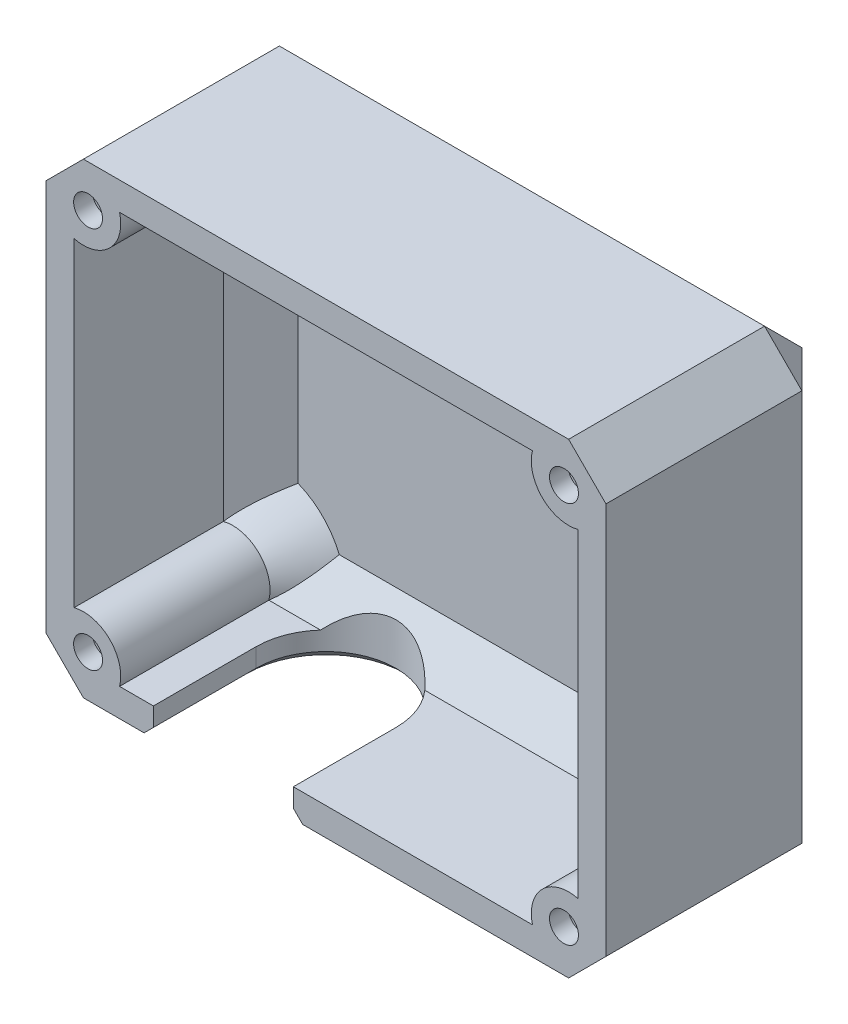
from build123d import *

# Parameters (mm, degrees)
SKETCH1_W           = 60
SKETCH1_H           = 50
BOSS_EXTRUDE1_DEPTH = 5
SKETCH2_W           = 60
SKETCH2_H           = 50
BOSS_EXTRUDE2_DEPTH = 20
CHAMFER1_SIZE       = 4
CHAMFER2_SIZE       = 4
CUT_EXTRUDE1_REACH  = 84.006
SKETCH5_R           = 1.55
CUT_EXTRUDE2_DEPTH  = 2
CHAMFER3_SIZE       = 1


with BuildPart() as part:
    # Sketch1 → Boss-Extrude1 (new body)
    with BuildSketch(Plane.XY):
        with Locations((30, 25)):
            Rectangle(SKETCH1_W, SKETCH1_H)
    extrude(amount=BOSS_EXTRUDE1_DEPTH)

    # Sketch2 → Boss-Extrude2 (add)
    with BuildSketch(Plane.XY.offset(5)):
        with Locations((30, 25)):
            Rectangle(SKETCH2_W, SKETCH2_H)
        with BuildLine():
            ThreePointArc((57, 7.872983346), (53.171572875, 6.828427125), (52.127016654, 3))
            Line((52.127016654, 3), (7.872983346, 3))
            ThreePointArc((7.872983346, 3), (6.828427125, 6.828427125), (3, 7.872983346))
            Line((3, 7.872983346), (3, 42.127016654))
            ThreePointArc((3, 42.127016654), (6.828427125, 43.171572875), (7.872983346, 47))
            Line((7.872983346, 47), (52.127016654, 47))
            ThreePointArc((52.127016654, 47), (53.171572875, 43.171572875), (57, 42.127016654))
            Line((57, 42.127016654), (57, 7.872983346))
        make_face(mode=Mode.SUBTRACT)
    extrude(amount=BOSS_EXTRUDE2_DEPTH)

    # Chamfer1
    chamfer1_edges = [part.edges().sort_by_distance(p)[0] for p in [
        (30, 3, 5),
        (6.828427125, 43.171572875, 5),
        (3, 25, 5),
        (30, 47, 5),
        (53.171572875, 43.171572875, 5),
        (57, 25, 5),
        (53.171572875, 6.828427125, 5),
        (6.828427125, 6.828427125, 5),
    ]]
    chamfer(chamfer1_edges, length=CHAMFER1_SIZE)

    # Chamfer2
    chamfer2_edges = [part.edges().sort_by_distance(p)[0] for p in [
        (60, 25, 0),
        (60, 50, 12.5),
        (30, 50, 0),
        (0, 50, 12.5),
        (0, 25, 0),
        (60, 0, 12.5),
        (30, 0, 0),
        (0, 0, 12.5),
    ]]
    chamfer(chamfer2_edges, length=CHAMFER2_SIZE)

    # Sketch3 → Cut-Extrude1 (cut, up to next)
    with BuildSketch(Plane.XZ, mode=Mode.PRIVATE) as cut_extrude1_sk1:
        with BuildLine():
            Line((11.5, 25), (11.5, 14))
            ThreePointArc((11.5, 14), (19, 6.5), (26.5, 14))
            Line((26.5, 14), (26.5, 25))
            Line((26.5, 25), (11.5, 25))
        make_face()
    cut_extrude1_tool1 = extrude(cut_extrude1_sk1.sketch, amount=-CUT_EXTRUDE1_REACH, mode=Mode.PRIVATE) & part.part
    add(cut_extrude1_tool1.solids().sort_by_distance((19, 0, 16.471806))[0], mode=Mode.SUBTRACT)

    # Sketch5 → Cut-Extrude2 (cut)
    with BuildSketch(Plane.XY.offset(25)):
        with Locations((4.5, 45.5)):
            Circle(SKETCH5_R)
        with Locations((55.5, 45.5)):
            Circle(SKETCH5_R)
        with Locations((55.5, 4.5)):
            Circle(SKETCH5_R)
        with Locations((4.5, 4.5)):
            Circle(SKETCH5_R)
    extrude(amount=-CUT_EXTRUDE2_DEPTH, mode=Mode.SUBTRACT)

    # Chamfer3
    chamfer3_edges = [part.edges().sort_by_distance(p)[0] for p in [
        (26.5, 0, 19.5),
        (11.5, 0, 19.5),
        (19, 0, 6.5),
    ]]
    chamfer(chamfer3_edges, length=CHAMFER3_SIZE)


solid = part.part
